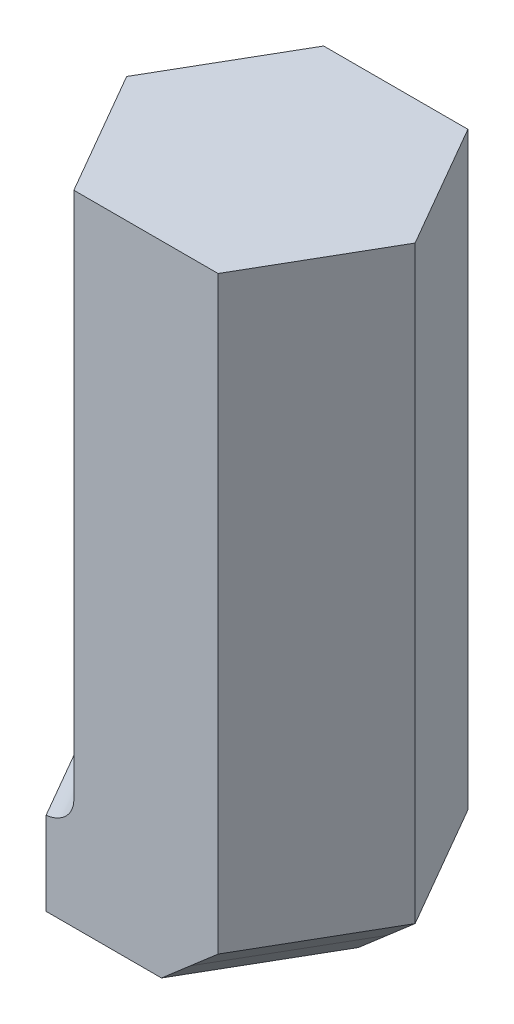
from build123d import *

# Parameters (mm, degrees)
EXTRUDE_1_DEPTH = 20
EXTRUDE_2_DEPTH = 3
CHAMFER_1_SIZE  = 2.1
CHAMFER_2_SIZE  = 0.9
FILLET_2_R      = 1


# Some blends are built 0.0001 mm under size
with BuildPart() as part:
    # 草图1 → 凸台-拉伸1 (new body)
    with BuildSketch(Plane(origin=(0, 0, 0), x_dir=(1, 0, 0), z_dir=(0, 1, 0))):
        Polygon((2.598076211, -4.5), (5.196152423, 0), (2.598076211, 4.5), (-2.598076211, 4.5), (-5.196152423, 0), (-2.598076211, -4.5), align=None)
    extrude(amount=EXTRUDE_1_DEPTH)

    # 草图2 → 凸台-拉伸2 (add)
    with BuildSketch(Plane(origin=(0, 0, 0), x_dir=(-1, 0, 0), z_dir=(0, -1, 0))):
        Polygon((6.196152423, 0), (3.598076211, 4.5), (-1.598076211, 4.5), (-4.196152423, 0), (-1.598076211, -4.5), (3.598076211, -4.5), align=None)
    extrude(amount=EXTRUDE_2_DEPTH)

    # 倒角1
    # the kernel refuses this chamfer: 2.1 mm, written as the material it adds along each edge
    with BuildSketch(Plane(origin=(-1.102190926, 0, -9.176999876), x_dir=(0.8656979742248804, 0.027495876610586372, -0.49981095845564816), z_dir=(0.49999999999999983, 0, 0.8660254037844388))) as chamfer_1_piece_1_section:
        Polygon((CHAMFER_1_SIZE * 0.999621916911, -CHAMFER_1_SIZE * 0.0274958766106), (-CHAMFER_1_SIZE * 0.0274958766106, -CHAMFER_1_SIZE * 0.999621916911), (0, 0), align=None)
    chamfer_1_piece_1 = extrude(amount=15.997220972, mode=Mode.PRIVATE)
    chamfer_1_piece_1 = split(chamfer_1_piece_1, bisect_by=Plane(origin=(3.647114317, -0.87342855, -2.683012702), z_dir=(-0.8660254037844421, 0, 0.49999999999999406)), keep=Keep.TOP, mode=Mode.PRIVATE)
    chamfer_1_piece_1 = split(chamfer_1_piece_1, bisect_by=Plane(origin=(3.19992905, -0.87342855, -4.5), z_dir=(0, 0, 1)), keep=Keep.TOP, mode=Mode.PRIVATE)
    chamfer_1_piece_1 = split(chamfer_1_piece_1, bisect_by=Plane(origin=(4.997078842, -0.87342855, -1.387245251), z_dir=(-0.8660254037844387, 0, -0.5000000000000003)), keep=Keep.TOP, mode=Mode.PRIVATE)
    add(chamfer_1_piece_1)
    with BuildSketch(Plane(origin=(6.89641956, 0, -4.676999876), x_dir=(0.8656979742248802, 0.027495876610586358, 0.49981095845564866), z_dir=(-0.5000000000000003, 0, 0.8660254037844386))) as chamfer_1_piece_2_section:
        Polygon((CHAMFER_1_SIZE * 0.999621916911, -CHAMFER_1_SIZE * 0.0274958766106), (-CHAMFER_1_SIZE * 0.0274958766106, -CHAMFER_1_SIZE * 0.999621916911), (0, 0), align=None)
    chamfer_1_piece_2 = extrude(amount=15.997220972, mode=Mode.PRIVATE)
    chamfer_1_piece_2 = split(chamfer_1_piece_2, bisect_by=Plane(origin=(3.647114317, -0.87342855, 2.683012702), z_dir=(-0.8660254037844353, 0, -0.500000000000006)), keep=Keep.TOP, mode=Mode.PRIVATE)
    chamfer_1_piece_2 = split(chamfer_1_piece_2, bisect_by=Plane(origin=(3.19992905, -0.87342855, 4.5), z_dir=(0, 0, -1)), keep=Keep.TOP, mode=Mode.PRIVATE)
    chamfer_1_piece_2 = split(chamfer_1_piece_2, bisect_by=Plane(origin=(4.997078842, -0.87342855, 1.387245251), z_dir=(-0.8660254037844388, 0, 0.49999999999999983)), keep=Keep.TOP, mode=Mode.PRIVATE)
    add(chamfer_1_piece_2)
    with BuildSketch(Plane(origin=(6.89641956, 0, -4.676999876), x_dir=(0.8656979742248802, 0.027495876610586358, 0.49981095845564866), z_dir=(-0.5000000000000003, 0, 0.8660254037844386))) as chamfer_1_piece_3a_section:
        Polygon((CHAMFER_1_SIZE * 0.999621916911, -CHAMFER_1_SIZE * 0.0274958766106), (-CHAMFER_1_SIZE * 0.0274958766106, -CHAMFER_1_SIZE * 0.999621916911), (0, 0), align=None)
    chamfer_1_piece_3a = extrude(amount=15.997220972, mode=Mode.PRIVATE)
    chamfer_1_piece_3a = split(chamfer_1_piece_3a, bisect_by=Plane(origin=(5.090413844, -0.863604647, 0.183144591), z_dir=(-0.8660254037844353, 0, -0.500000000000006)), keep=Keep.TOP, mode=Mode.PRIVATE)
    chamfer_1_piece_3a = split(chamfer_1_piece_3a, bisect_by=Plane(origin=(5.032629581, -0.863604647, -0.28322987), z_dir=(-0.8660254037844421, 0, 0.49999999999999406)), keep=Keep.TOP, mode=Mode.PRIVATE)
    chamfer_1_piece_3a = split(chamfer_1_piece_3a, bisect_by=Plane(origin=(4.282629581, -0.863604647, 0.149782832), z_dir=(0.8660254037844388, 0, -0.49999999999999983)), keep=Keep.TOP, mode=Mode.PRIVATE)
    with BuildSketch(Plane(origin=(-1.102190926, 0, -9.176999876), x_dir=(0.8656979742248804, 0.027495876610586372, -0.49981095845564816), z_dir=(0.49999999999999983, 0, 0.8660254037844388))) as chamfer_1_piece_3b_section:
        Polygon((CHAMFER_1_SIZE * 0.999621916911, -CHAMFER_1_SIZE * 0.0274958766106), (-CHAMFER_1_SIZE * 0.0274958766106, -CHAMFER_1_SIZE * 0.999621916911), (0, 0), align=None)
    chamfer_1_piece_3b = extrude(amount=15.997220972, mode=Mode.PRIVATE)
    chamfer_1_piece_3b = split(chamfer_1_piece_3b, bisect_by=Plane(origin=(5.032629581, -0.863604647, 0.28322987), z_dir=(-0.8660254037844353, 0, -0.500000000000006)), keep=Keep.TOP, mode=Mode.PRIVATE)
    chamfer_1_piece_3b = split(chamfer_1_piece_3b, bisect_by=Plane(origin=(5.090413844, -0.863604647, -0.183144591), z_dir=(-0.8660254037844421, 0, 0.49999999999999406)), keep=Keep.TOP, mode=Mode.PRIVATE)
    chamfer_1_piece_3b = split(chamfer_1_piece_3b, bisect_by=Plane(origin=(4.282629581, -0.863604647, -0.149782832), z_dir=(0.8660254037844387, 0, 0.5000000000000003)), keep=Keep.TOP, mode=Mode.PRIVATE)
    chamfer_1_piece_3 = chamfer_1_piece_3a & chamfer_1_piece_3b
    add(chamfer_1_piece_3)

    # 倒角2
    chamfer_2_edges = [part.edges().sort_by_distance(p)[0] for p in [
        (2.897114317, -3, 2.25),
        (2.897114317, -3, -2.25),
    ]]
    chamfer(chamfer_2_edges, length=CHAMFER_2_SIZE - 0.0001)  # a hair under: the kernel refuses the full size

    # 圆角2
    # the kernel refuses this fillet: 1 mm, written as the material it adds along each edge
    with BuildSketch(Plane(origin=(-1.359345253, 0, -6.645544957), x_dir=(-0.8660254037844353, 5.384295521873835e-15, -0.500000000000006), z_dir=(-0.500000000000006, 0, 0.8660254037844353))) as fillet_2_piece_1_section:
        with BuildLine():
            CenterArc((1, -0.990984767), FILLET_2_R, 97.699329946, 82.300670054)
            Line((0, -0.990984767), (-0.02, -0.990984767))
            Line((-0.02, -0.990984767), (-0.02, 0))
            Line((-0.02, 0), (0, 0.02))
            ThreePointArc((0, 0.02), (0.433012702, 0.02), (0.863345912, 0.019819695))
            Line((0.863345912, 0.019819695), (0.866025404, 0))
        make_face()
    fillet_2_piece_1 = extrude(amount=10.151076256, mode=Mode.PRIVATE)
    fillet_2_piece_1 = split(fillet_2_piece_1, bisect_by=Plane(origin=(-4.072160792, 0.234330223, -4.5), z_dir=(0, 0, 1)), keep=Keep.TOP, mode=Mode.PRIVATE)
    fillet_2_piece_1 = split(fillet_2_piece_1, bisect_by=Plane(origin=(-5.933194713, 0.234330223, -1.276594694), z_dir=(0.8660254037844423, 0, -0.49999999999999395)), keep=Keep.TOP, mode=Mode.PRIVATE)
    add(fillet_2_piece_1)
    with BuildSketch(Plane(origin=(-6.434883381, 0, -2.145544957), x_dir=(-0.8660254037844421, 5.3842955218737e-15, 0.4999999999999939), z_dir=(0.49999999999999395, 0, 0.8660254037844423))) as fillet_2_piece_2_section:
        with BuildLine():
            CenterArc((1, -0.990984767), FILLET_2_R, 97.699329946, 82.300670054)
            Line((0, -0.990984767), (-0.02, -0.990984767))
            Line((-0.02, -0.990984767), (-0.02, 0))
            Line((-0.02, 0), (0, 0.02))
            ThreePointArc((0, 0.02), (0.433012702, 0.02), (0.863345912, 0.019819695))
            Line((0.863345912, 0.019819695), (0.866025404, 0))
        make_face()
    fillet_2_piece_2 = extrude(amount=10.151076256, mode=Mode.PRIVATE)
    fillet_2_piece_2 = split(fillet_2_piece_2, bisect_by=Plane(origin=(-4.072160792, 0.234330223, 4.5), z_dir=(0, 0, -1)), keep=Keep.TOP, mode=Mode.PRIVATE)
    fillet_2_piece_2 = split(fillet_2_piece_2, bisect_by=Plane(origin=(-5.933194713, 0.234330223, 1.276594694), z_dir=(0.8660254037844353, 0, 0.500000000000006)), keep=Keep.TOP, mode=Mode.PRIVATE)
    add(fillet_2_piece_2)
    with BuildSketch(Plane(origin=(-6.434883381, 0, -2.145544957), x_dir=(-0.8660254037844421, 5.3842955218737e-15, 0.4999999999999939), z_dir=(0.49999999999999395, 0, 0.8660254037844423))) as fillet_2_piece_3a_section:
        with BuildLine():
            CenterArc((1, -0.990984767), FILLET_2_R, 97.699329946, 82.300670054)
            Line((0, -0.990984767), (-0.02, -0.990984767))
            Line((-0.02, -0.990984767), (-0.02, 0))
            Line((-0.02, 0), (0, 0.02))
            ThreePointArc((0, 0.02), (0.433012702, 0.02), (0.863345912, 0.019819695))
            Line((0.863345912, 0.019819695), (0.866025404, 0))
        make_face()
    fillet_2_piece_3a = extrude(amount=10.151076256, mode=Mode.PRIVATE)
    fillet_2_piece_3a = split(fillet_2_piece_3a, bisect_by=Plane(origin=(-5.943047398, 0.228517216, -0.438390763), z_dir=(0.8660254037844385, 0, 0.5000000000000004)), keep=Keep.TOP, mode=Mode.PRIVATE)
    fillet_2_piece_3a = split(fillet_2_piece_3a, bisect_by=Plane(origin=(-5.193047398, 0.228517216, -0.005378061), z_dir=(-0.8660254037844353, 0, -0.500000000000006)), keep=Keep.TOP, mode=Mode.PRIVATE)
    with BuildSketch(Plane(origin=(-1.359345253, 0, -6.645544957), x_dir=(-0.8660254037844353, 5.384295521873835e-15, -0.500000000000006), z_dir=(-0.500000000000006, 0, 0.8660254037844353))) as fillet_2_piece_3b_section:
        with BuildLine():
            CenterArc((1, -0.990984767), FILLET_2_R, 97.699329946, 82.300670054)
            Line((0, -0.990984767), (-0.02, -0.990984767))
            Line((-0.02, -0.990984767), (-0.02, 0))
            Line((-0.02, 0), (0, 0.02))
            ThreePointArc((0, 0.02), (0.433012702, 0.02), (0.863345912, 0.019819695))
            Line((0.863345912, 0.019819695), (0.866025404, 0))
        make_face()
    fillet_2_piece_3b = extrude(amount=10.151076256, mode=Mode.PRIVATE)
    fillet_2_piece_3b = split(fillet_2_piece_3b, bisect_by=Plane(origin=(-5.943047398, 0.228517216, 0.438390763), z_dir=(0.8660254037844388, 0, -0.49999999999999967)), keep=Keep.TOP, mode=Mode.PRIVATE)
    fillet_2_piece_3b = split(fillet_2_piece_3b, bisect_by=Plane(origin=(-5.193047398, 0.228517216, 0.005378061), z_dir=(-0.8660254037844423, 0, 0.49999999999999395)), keep=Keep.TOP, mode=Mode.PRIVATE)
    fillet_2_piece_3 = fillet_2_piece_3a & fillet_2_piece_3b
    add(fillet_2_piece_3)


solid = part.part
